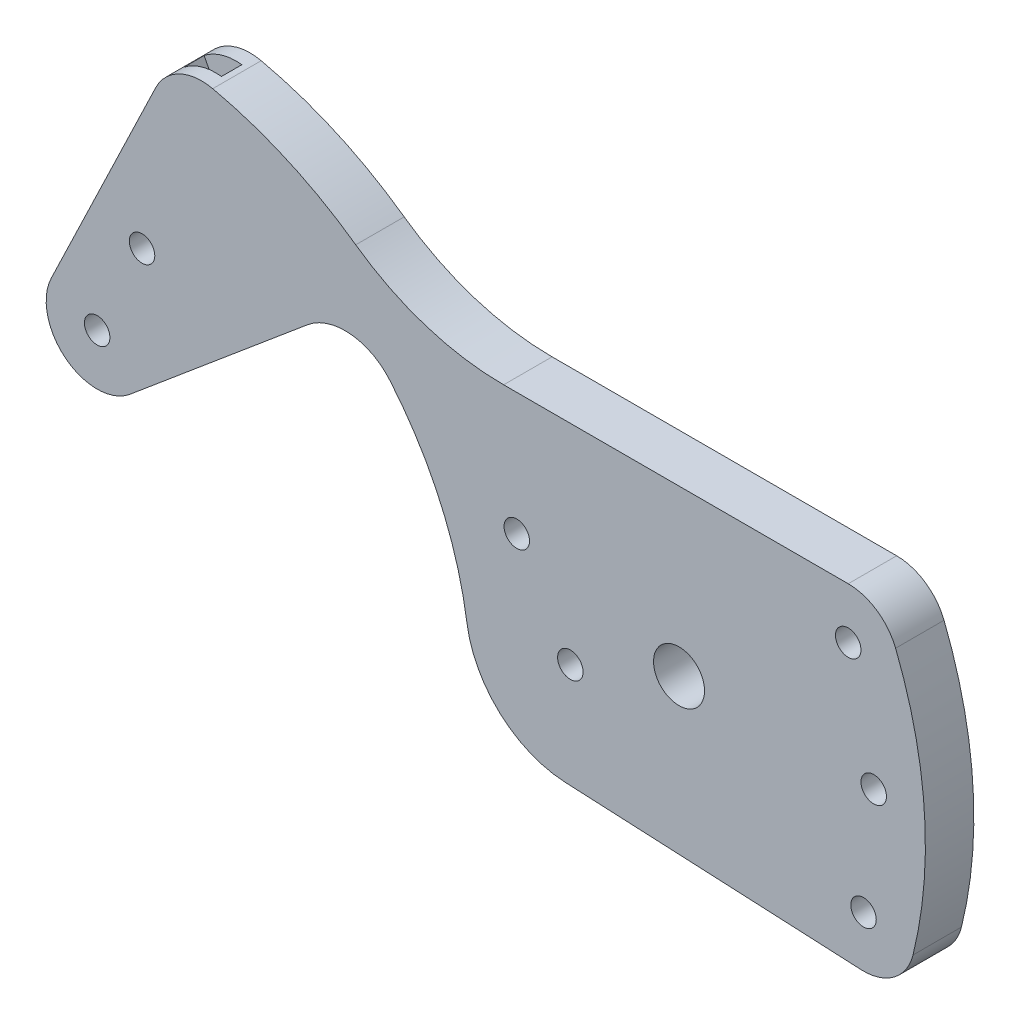
from build123d import *

# Parameters (mm, degrees)
SKETCH1_R           = 2.5
SKETCH1_R_2         = 5
BOSS_EXTRUDE1_DEPTH = 4.75
CUT_EXTRUDE1_DEPTH  = 2


with BuildPart() as part:
    # Sketch1 → Boss-Extrude1 (new, symmetric)
    with BuildSketch(Plane.XY):
        with BuildLine():
            Line((-22.308767332, -29.181670657), (35.698943118, -31.988315456))
            ThreePointArc((35.698943118, -31.988315456), (42.1516901, -30.02280497), (45.888257007, -24.406823948))
            ThreePointArc((45.888257007, -24.406823948), (48.128157677, 1.060560267), (42.475146865, 25.993435805))
            ThreePointArc((42.475146865, 25.993435805), (38.797626972, 30.574489653), (33.182217728, 32.3))
            Line((33.182217728, 32.3), (-34.397529085, 32.3))
            ThreePointArc((-34.397529085, 32.3), (-49.622555092, 34.67439152), (-63.401574193, 41.572056677))
            ThreePointArc((-63.401574193, 41.572056677), (-76.799263642, 49.225759558), (-91.448521696, 54.071013816))
            ThreePointArc((-91.448521696, 54.071013816), (-97.990041102, 53.309279516), (-102.639296293, 48.644931604))
            Line((-102.639296293, 48.644931604), (-123.129936653, 6.033713582))
            ThreePointArc((-123.129936653, 6.033713582), (-120.252485213, -6.197177966), (-107.689906175, -5.960444431))
            Line((-107.689906175, -5.960444431), (-72.864818345, 23.261273923))
            ThreePointArc((-72.864818345, 23.261273923), (-64.470178387, 25.908093735), (-56.662687309, 21.843771132))
            ThreePointArc((-56.662687309, 21.843771132), (-46.805355693, 6.125218695), (-41.605017691, -11.684788659))
            ThreePointArc((-41.605017691, -11.684788659), (-35.091884298, -23.890622031), (-22.308767332, -29.181670657))
        make_face()
        with Locations((36.182217728, -22)):
            Circle(SKETCH1_R, mode=Mode.SUBTRACT)
        with Locations((-21.317782272, -8.7)):
            Circle(SKETCH1_R, mode=Mode.SUBTRACT)
        Circle(SKETCH1_R_2, mode=Mode.SUBTRACT)
        with Locations((-31.817782272, 8.3)):
            Circle(SKETCH1_R, mode=Mode.SUBTRACT)
        with Locations((38.182217728, -0.1)):
            Circle(SKETCH1_R, mode=Mode.SUBTRACT)
        with Locations((33.182217728, 22.3)):
            Circle(SKETCH1_R, mode=Mode.SUBTRACT)
        with Locations((-105.317782272, 20)):
            Circle(SKETCH1_R, mode=Mode.SUBTRACT)
        with Locations((-114.117782272, 1.7)):
            Circle(SKETCH1_R, mode=Mode.SUBTRACT)
    extrude(amount=BOSS_EXTRUDE1_DEPTH, both=True)

    # Sketch2 → Cut-Extrude1 (cut, symmetric)
    with BuildSketch(Plane.XY):
        with BuildLine():
            Line((-78.227129447, 18.761760655), (-91.668909505, 44.876871439))
            Line((-91.668909505, 44.876871439), (-92.486661389, 54.245970368))
            ThreePointArc((-92.486661389, 54.245970368), (-96.402275052, 53.918435936), (-99.889427329, 52.10761343))
            Line((-99.889427329, 52.10761343), (-95.58537432, 43.745564604))
            Line((-95.58537432, 43.745564604), (-92.369017313, 6.895307763))
            Line((-92.369017313, 6.895307763), (-78.227129447, 18.761760655))
        make_face()
    extrude(amount=CUT_EXTRUDE1_DEPTH, both=True, mode=Mode.SUBTRACT)


solid = part.part
